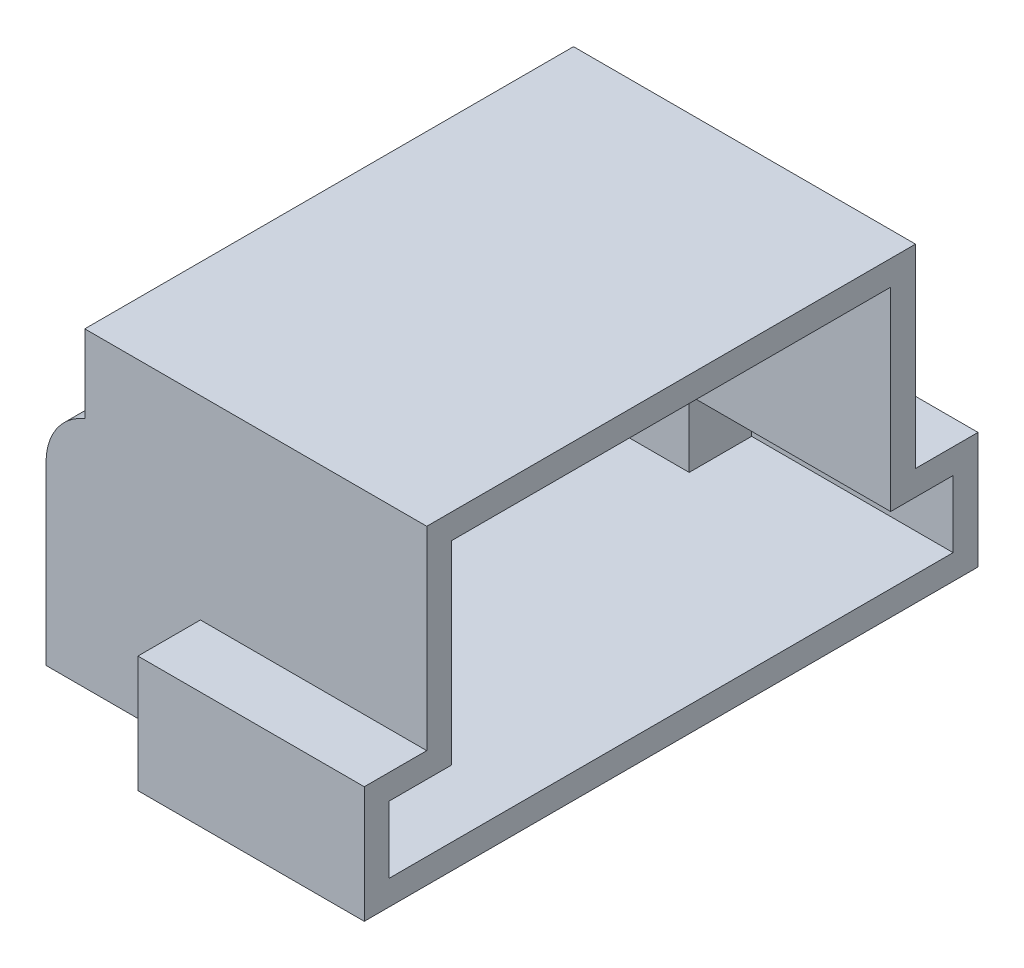
from build123d import *

# Parameters (mm, degrees)
SKETCH1_W           = 4.6228
SKETCH1_H           = 12.5349
BOSS_EXTRUDE1_DEPTH = 2.38125
BOSS_EXTRUDE2_DEPTH = 6.35
SKETCH3_W           = 0.791761441
SKETCH3_H           = 4.7625
BOSS_EXTRUDE3_DEPTH = 0.79375
SKETCH4_W           = 0.791761441
SKETCH4_H           = 4.7625
BOSS_EXTRUDE4_DEPTH = 0.79375
FILLET1_R           = 1.27
SHELL1_START        = -1.8542
SHELL1_OUTLINE_W    = 5.334
SHELL1_OUTLINE_H    = 8.9662
SHELL1_DEPTH        = 6.477
SHELL1_START_2      = 0.508
SHELL1_2_OUTLINE_W  = 1.36525
SHELL1_2_OUTLINE_H  = 1.27635
SHELL1_2_DEPTH      = 4.1148


# Read off the part's stored shape, not the designer's step: Shell1
with BuildPart() as part:
    # Sketch1 → Boss-Extrude1 (new body)
    with BuildSketch(Plane(origin=(0, 0, 0), x_dir=(1, 0, 0), z_dir=(0, 1, 0))):
        with Locations((2.3114, 6.26745)):
            Rectangle(SKETCH1_W, SKETCH1_H)
    extrude(amount=BOSS_EXTRUDE1_DEPTH)

    # Sketch2 → Boss-Extrude2 (add)
    with BuildSketch(Plane(origin=(0, 0, 0), x_dir=(-1, 0, 0), z_dir=(0, -1, 0))):
        Polygon((-4.6228, 6.26745), (-4.6228, 11.25855), (2.3622, 11.25855), (2.3622, 1.27635), (-4.6228, 1.27635), align=None)
    extrude(amount=-BOSS_EXTRUDE2_DEPTH)

    # Sketch3 → Boss-Extrude3 (add)
    with BuildSketch(Plane.XY.offset(-1.27635)):
        with Locations((-2.758080721, 2.38125)):
            Rectangle(SKETCH3_W, SKETCH3_H)
    extrude(amount=-BOSS_EXTRUDE3_DEPTH)

    # Sketch4 → Boss-Extrude4 (add)
    with BuildSketch(Plane(origin=(0, 0, -11.25855), x_dir=(-1, 0, 0), z_dir=(0, 0, -1))):
        with Locations((2.758080721, 2.38125)):
            Rectangle(SKETCH4_W, SKETCH4_H)
    extrude(amount=-BOSS_EXTRUDE4_DEPTH)

    # Fillet1
    # the kernel refuses this fillet: 1.27 mm, written as the material it takes off along each edge
    with BuildSketch(Plane(origin=(-3.153961441, 4.7625, 1.664937857), x_dir=(1, 0, 0), z_dir=(0, 0, -1))) as fillet1_piece_1:
        with BuildLine():
            CenterArc((1.27, 1.176515143), FILLET1_R, 180, 67.878878404)
            Line((0, 1.176515143), (-0.0254, 1.176515143))
            Line((-0.0254, 1.176515143), (-0.0254, 0))
            Line((-0.0254, 0), (0, -0.0254))
            ThreePointArc((0, -0.0254), (0.395880721, -0.0254), (0.78219667, -0.023530303))
            Line((0.78219667, -0.023530303), (0.791761441, 0))
        make_face()
    extrude(amount=6.676325713, mode=Mode.SUBTRACT)
    with BuildSketch(Plane(origin=(-3.153961441, 4.7625, -14.199837857), x_dir=(0, -1, 0), z_dir=(0, 0, 1))) as fillet1_piece_2:
        with BuildLine():
            CenterArc((1.176515143, 1.27), FILLET1_R, 202.121121596, 67.878878404)
            Line((0, 0.791761441), (-0.023530303, 0.78219667))
            ThreePointArc((-0.023530303, 0.78219667), (-0.0254, 0.395880721), (-0.0254, 0))
            Line((-0.0254, 0), (0, -0.0254))
            Line((0, -0.0254), (1.176515143, -0.0254))
            Line((1.176515143, -0.0254), (1.176515143, 0))
        make_face()
    extrude(amount=6.676325713, mode=Mode.SUBTRACT)

    # Shell1 outline → Shell1 (cut)
    with BuildSketch(Plane.YZ.offset(SHELL1_START)):
        with Locations((3.175, -6.26745)):
            Rectangle(SHELL1_OUTLINE_W, SHELL1_OUTLINE_H)
    extrude(amount=SHELL1_DEPTH, mode=Mode.SUBTRACT)

    # Shell1 2 outline → Shell1 2 (cut)
    with BuildSketch(Plane.YZ.offset(SHELL1_START_2)):
        with Locations((1.190625, -11.388725)):
            Rectangle(SHELL1_2_OUTLINE_W, SHELL1_2_OUTLINE_H)
        with Locations((1.190625, -1.146175)):
            Rectangle(SHELL1_2_OUTLINE_W, SHELL1_2_OUTLINE_H)
    extrude(amount=SHELL1_2_DEPTH, mode=Mode.SUBTRACT)


solid = part.part
